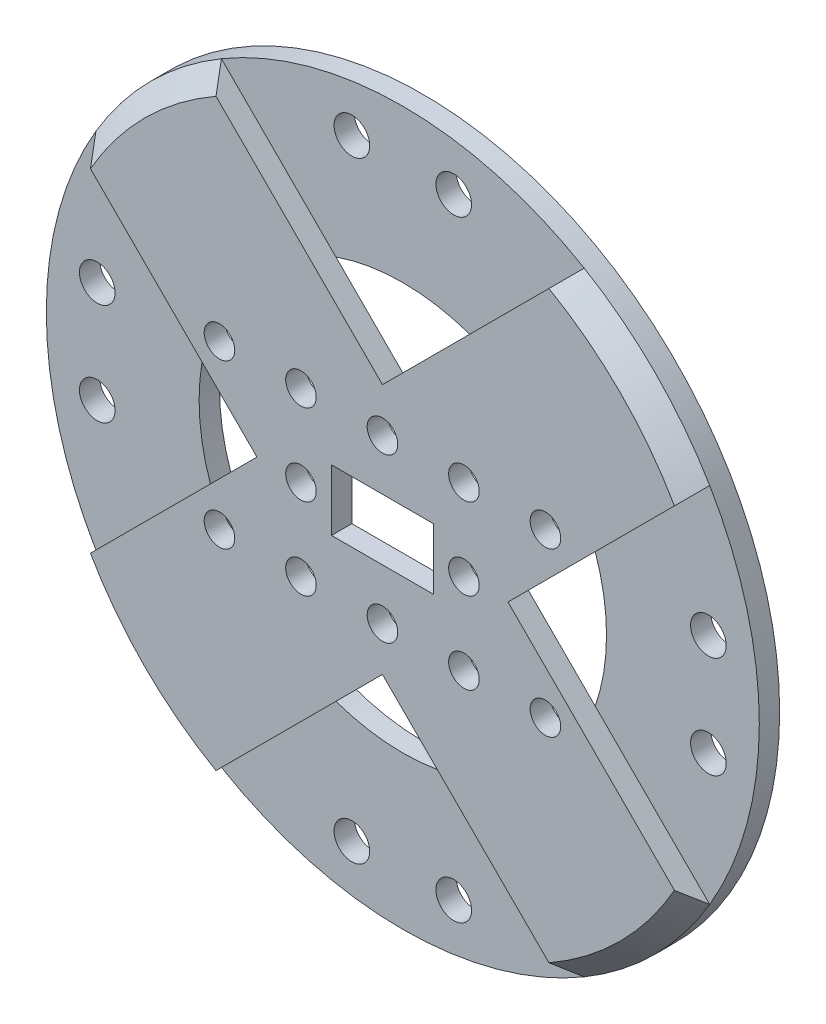
from build123d import *
from build123d.topology import SkipClean

# Parameters (mm, degrees)
SKETCH1_R                    = 35
SKETCH1_R_2                  = 20
BOSS_EXTRUDE1_DEPTH          = 2
SKETCH2_R                    = 1.75
CUT_EXTRUDE1_DEPTH           = 50.537864306
CIRPATTERN1_COUNT            = 4
BOSS_EXTRUDE2_DEPTH          = 2
CHAMFER1_SIZE                = 2
CIRPATTERN2_COUNT            = 2
CIRPATTERN2_ANGLE            = 90
CHAMFER1_OF_CIRPATTERN2_SIZE = 2
SKETCH5_R                    = 1.5
SKETCH5_W                    = 10
SKETCH5_H                    = 6
CUT_EXTRUDE2_DEPTH           = 50.658836072


with BuildPart() as part:
    # Sketch1 → Boss-Extrude1 (new body)
    with BuildSketch(Plane.XY):
        Circle(SKETCH1_R)
        Circle(SKETCH1_R_2, mode=Mode.SUBTRACT)
    extrude(amount=BOSS_EXTRUDE1_DEPTH)

    # Sketch2 → Cut-Extrude1 (cut, through all)
    with BuildSketch(Plane.XY.offset(2)):
        with Locations((5, 30)):
            Circle(SKETCH2_R)
        with Locations((-5, 30)):
            Circle(SKETCH2_R)
    cut_extrude1 = extrude(amount=-CUT_EXTRUDE1_DEPTH, mode=Mode.SUBTRACT)

    # CirPattern1: Cut-Extrude1 ×4 about axis
    cirpattern1_axis = Axis((0, 0, 0), (0, 0, 1))
    for i in range(1, CIRPATTERN1_COUNT):
        add(cut_extrude1.rotate(cirpattern1_axis, i * 360 / CIRPATTERN1_COUNT), mode=Mode.SUBTRACT)

    # Sketch3 → Boss-Extrude2 (add)
    with SkipClean():  # the faces are left unmerged after this step: merging them gives an invalid solid
        with BuildSketch(Plane.XY.offset(2)):
            with BuildLine():
                Line((-30.130645656, -17.80854268), (17.80854268, 30.130645656))
                ThreePointArc((17.80854268, 30.130645656), (24.748737342, 24.748737342), (30.130645656, 17.80854268))
                Line((30.130645656, 17.80854268), (-17.80854268, -30.130645656))
                ThreePointArc((-17.80854268, -30.130645656), (-24.748737342, -24.748737342), (-30.130645656, -17.80854268))
            make_face()
        boss_extrude2 = extrude(amount=BOSS_EXTRUDE2_DEPTH)

    # Chamfer1
    chamfer1_edges = [part.edges().sort_by_distance(p)[0] for p in [
        (-24.748737342, -24.748737342, 4),
        (24.748737342, 24.748737342, 4),
    ]]
    chamfer(chamfer1_edges, length=CHAMFER1_SIZE - 0.0001)  # a hair under: the kernel refuses the full size

    # CirPattern2: Boss-Extrude2 ×2 about axis
    with SkipClean():  # the faces are left unmerged after this step: merging them gives an invalid solid
        cirpattern2_axis = Axis((0, 0, 0), (0, 0, 1))
        for i in range(1, CIRPATTERN2_COUNT):
            add(boss_extrude2.rotate(cirpattern2_axis, i * CIRPATTERN2_ANGLE / (CIRPATTERN2_COUNT - 1)))

    # Chamfer1 of CirPattern2
    chamfer1_of_cirpattern2_edges = [part.edges().sort_by_distance(p)[0] for p in [
        (24.748737342, -24.748737342, 4),
        (-24.748737342, 24.748737342, 4),
    ]]
    chamfer(chamfer1_of_cirpattern2_edges, length=CHAMFER1_OF_CIRPATTERN2_SIZE - 0.0001)  # a hair under: the kernel refuses the full size

    # Sketch5 → Cut-Extrude2 (cut, through all)
    with BuildSketch(Plane.XY.offset(4)):
        with Locations((0, 8)):
            Circle(SKETCH5_R)
        with Locations((-8, 8)):
            Circle(SKETCH5_R)
        with Locations((-8, 0)):
            Circle(SKETCH5_R)
        with Locations((-8, -8)):
            Circle(SKETCH5_R)
        with Locations((8, -8)):
            Circle(SKETCH5_R)
        with Locations((8, 0)):
            Circle(SKETCH5_R)
        with Locations((8, 8)):
            Circle(SKETCH5_R)
        with Locations((0, -8)):
            Circle(SKETCH5_R)
        with Locations((-16, 8)):
            Circle(SKETCH5_R)
        with Locations((-16, 0)):
            Circle(SKETCH5_R)
        with Locations((-16, -8)):
            Circle(SKETCH5_R)
        with Locations((16, -8)):
            Circle(SKETCH5_R)
        with Locations((16, 0)):
            Circle(SKETCH5_R)
        with Locations((16, 8)):
            Circle(SKETCH5_R)
        Rectangle(SKETCH5_W, SKETCH5_H)
    extrude(amount=-CUT_EXTRUDE2_DEPTH, mode=Mode.SUBTRACT)


solid = part.part
